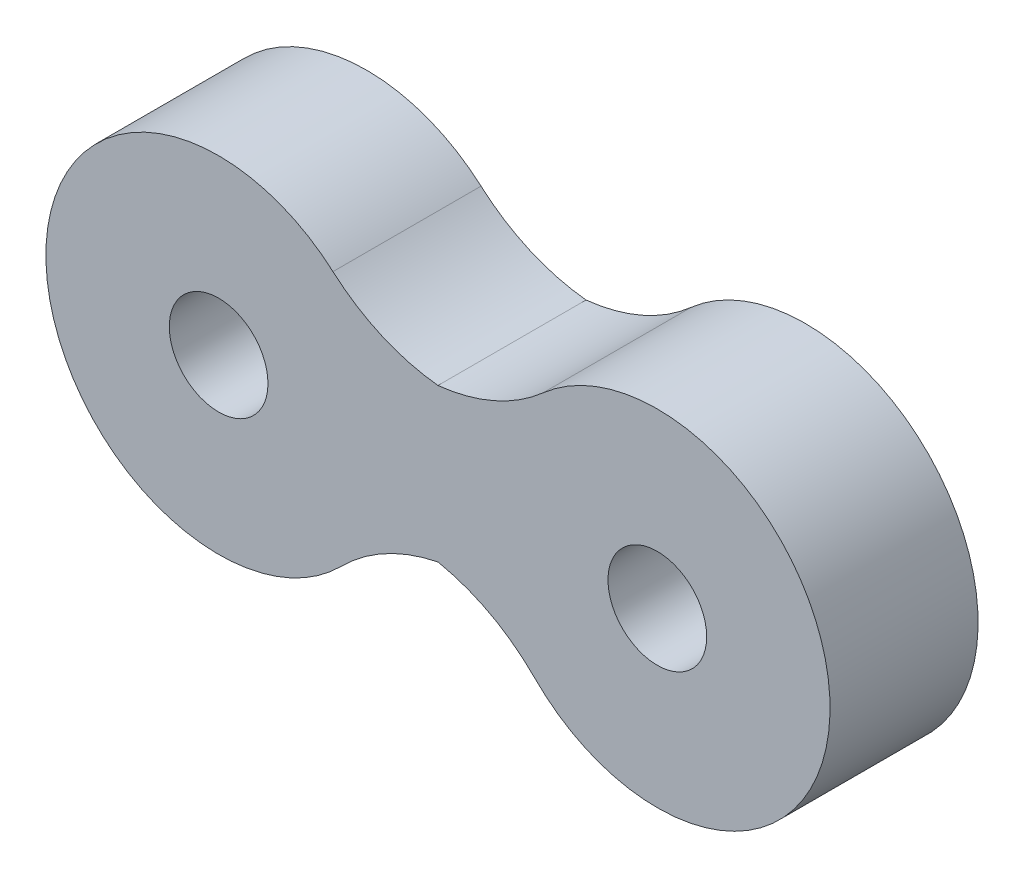
from build123d import *

# Parameters (mm, degrees)
SKETCH_1_R      = 1
EXTRUDE_1_DEPTH = 3
FILLET_1_R      = 3.81


with BuildPart() as part:
    # 스케치1 → 보스-돌출1 (new body)
    with BuildSketch(Plane.XY):
        with BuildLine():
            ThreePointArc((1.360143251, -0.016380398), (7.940783027, -1.841517038), (1.212921566, -3.01276585))
            ThreePointArc((1.212921566, -3.01276585), (0, -2.999009296), (-1.212921566, -3.01276585))
            ThreePointArc((-1.212921566, -3.01276585), (-7.940783027, -1.841517038), (-1.360143251, -0.016380398))
            ThreePointArc((-1.360143251, -0.016380398), (0, 0), (1.360143251, -0.016380398))
        make_face()
        with Locations((-4.445, -1.669758406)):
            Circle(SKETCH_1_R, mode=Mode.SUBTRACT)
        with Locations((4.445, -1.669758406)):
            Circle(SKETCH_1_R, mode=Mode.SUBTRACT)
    extrude(amount=EXTRUDE_1_DEPTH)

    # 필렛1
    # the kernel refuses this fillet: 3.81 mm, written as the material it adds along each edge
    with BuildSketch(Plane(origin=(1.212921566, -3.01276585, 0), x_dir=(0.5541029817307234, -0.8324481278957396, 0), z_dir=(0, 0, 1))) as fillet_1_piece_1:
        with BuildLine():
            CenterArc((2.078362303, -3.73891854), FILLET_1_R, 101.084875911, 46.128957788)
            ThreePointArc((-1.12469468, -1.675783557), (-0.570253257, -0.832585758), (0, 0))
            ThreePointArc((0, 0), (0.672920265, -0.065297929), (1.345840529, 0))
        make_face()
    extrude(amount=3)
    with BuildSketch(Plane(origin=(-1.212921566, -3.01276585, 0), x_dir=(-0.5541029817307197, -0.8324481278957422, 0), z_dir=(0, 0, 1))) as fillet_1_piece_2:
        with BuildLine():
            CenterArc((2.078362303, 3.73891854), FILLET_1_R, 212.786166302, 46.128957788)
            ThreePointArc((-1.12469468, 1.675783557), (-0.570253257, 0.832585758), (0, 0))
            ThreePointArc((0, 0), (0.672920265, 0.065297929), (1.345840529, 0))
        make_face()
    extrude(amount=3)
    with BuildSketch(Plane(origin=(1.360143251, -0.016380398, 0), x_dir=(-0.9999615504987989, 0.008769123333507087, 0), z_dir=(0, 0, 1))) as fillet_1_piece_3:
        with BuildLine():
            CenterArc((1.788298707, -3.809553141), FILLET_1_R, 90.877535516, 41.082301134)
            ThreePointArc((-0.759103528, -0.976384975), (-0.336083058, -0.521987813), (0, 0))
            ThreePointArc((0, 0), (0.864973735, -0.006624048), (1.72994747, 0))
        make_face()
    extrude(amount=3)
    with BuildSketch(Plane(origin=(-1.360143251, -0.016380398, 0), x_dir=(-0.6206853131175095, 0.7840597822106544, 0), z_dir=(0, 0, 1))) as fillet_1_piece_4:
        with BuildLine():
            CenterArc((1.909904861, -3.750062775), FILLET_1_R, 100.176406591, 41.082301134)
            ThreePointArc((-1.061817419, -1.365745957), (-0.525679205, -0.686938726), (0, 0))
            ThreePointArc((0, 0), (0.618378077, -0.055060443), (1.236756154, 0))
        make_face()
    extrude(amount=3)


solid = part.part
